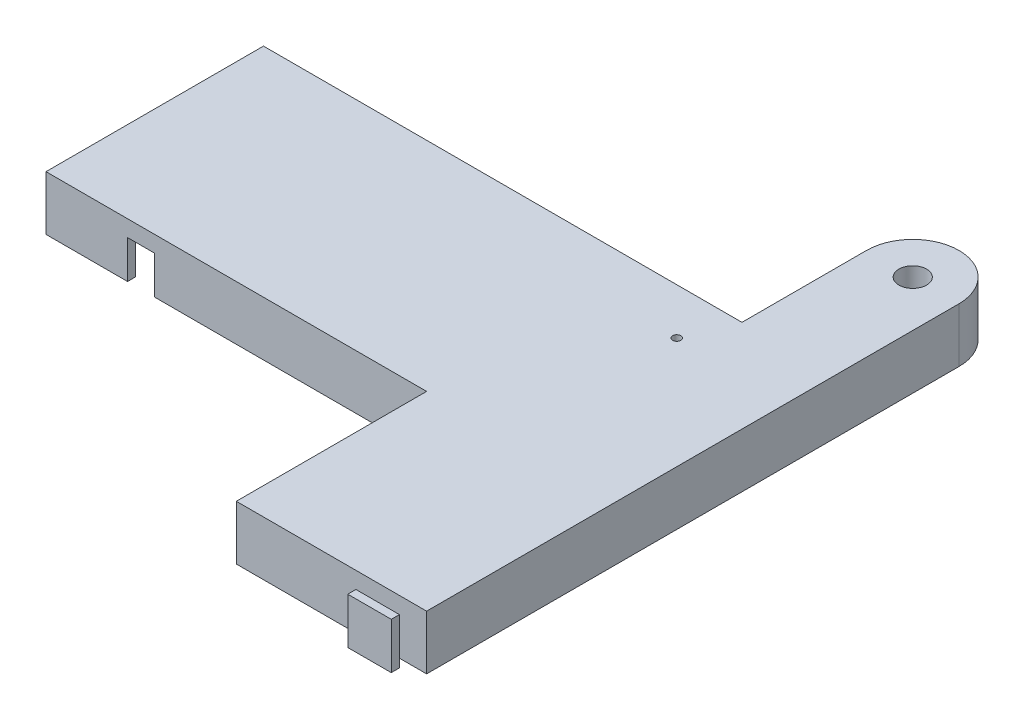
from build123d import *

# Parameters (mm, degrees)
CORNERBOSS_EXTRUDE1_DEPTH               = 20
SHELL1_T                                = -3
PADSKETCH2_R                            = 12
PADSKETCH2_R_2                          = 5
PADBOSS_EXTRUDE2_DEPTH                  = 10
STEPPERRODHOLESKETCH3_R                 = 5.1
STEPPERRODHOLESKETCH3_R_2               = 1.5
STEPPERRODHOLECUT_EXTRUDE1_DEPTH        = 255.298998474
THREADEDNUTMOUNTHOLESSKETCH4_R          = 1
THREADEDNUTMOUNTHOLESCUT_EXTRUDE2_DEPTH = 10
TLPEGHOLESKETCH1_W                      = 10
TLPEGHOLESKETCH1_H                      = 14
TLPEGHOLECUT_EXTRUDE1_DEPTH             = 3
BOTTOMPEGSKETCH2_W                      = 9.8
BOTTOMPEGSKETCH2_H                      = 13.9
BOTTOMPEGBOSS_EXTRUDE1_DEPTH            = 3.1
BOTTOMPEGCAPSKETCH3_W                   = 16
BOTTOMPEGCAPSKETCH3_H                   = 17
BOTTOMPEGCAPBOSS_EXTRUDE2_DEPTH         = 3
BEDCENTERHOLECUTSKETCH1_W               = 10
BEDCENTERHOLECUTSKETCH1_H               = 14
BEDCENTERHOLECUT_EXTRUDE1_DEPTH         = 3


with BuildPart() as part:
    # CornerSketch1 → CornerBoss-Extrude1 (new body)
    with BuildSketch(Plane(origin=(0, 0, 0), x_dir=(1, 0, 0), z_dir=(0, 1, 0))):
        with BuildLine():
            Line((210, -70), (140, -70))
            Line((140, -70), (140, 0))
            Line((140, 0), (0, 0))
            Line((0, 0), (0, 80))
            Line((0, 80), (176, 80))
            Line((176, 80), (176, 125.825))
            ThreePointArc((176, 125.825), (193, 142.825), (210, 125.825))
            Line((210, 125.825), (210, -70))
        make_face()
    extrude(amount=CORNERBOSS_EXTRUDE1_DEPTH)

    # Shell1
    shell1_openings = [part.faces().sort_by_distance(p)[0] for p in [
        (126.932214483, 0, -30.416556174),
    ]]
    offset(amount=SHELL1_T, openings=shell1_openings, kind=Kind.INTERSECTION)

    # PadSketch2 → PadBoss-Extrude2 (add)
    with BuildSketch(Plane.XZ.offset(-17)):
        with Locations((193, -125.825)):
            Circle(PADSKETCH2_R)
        with Locations((169, -63)):
            Circle(PADSKETCH2_R_2)
    extrude(amount=PADBOSS_EXTRUDE2_DEPTH)

    # StepperRodHoleSketch3 → StepperRodHoleCut-Extrude1 (cut, through all)
    with BuildSketch(Plane.XZ.offset(-7)):
        with Locations((193, -125.825)):
            Circle(STEPPERRODHOLESKETCH3_R)
        with Locations((169, -63)):
            Circle(STEPPERRODHOLESKETCH3_R_2)
    extrude(amount=-STEPPERRODHOLECUT_EXTRUDE1_DEPTH, mode=Mode.SUBTRACT)

    # ThreadedNutMountHolesSketch4 → ThreadedNutMountHolesCut-Extrude2 (cut)
    with BuildSketch(Plane(origin=(0, 7, 0), x_dir=(-1, 0, 0), z_dir=(0, -1, 0))):
        with Locations((-193, 133.825)):
            Circle(THREADEDNUTMOUNTHOLESSKETCH4_R)
        with Locations((-185, 125.825)):
            Circle(THREADEDNUTMOUNTHOLESSKETCH4_R)
        with Locations((-201, 125.825)):
            Circle(THREADEDNUTMOUNTHOLESSKETCH4_R)
        with Locations((-193, 117.825)):
            Circle(THREADEDNUTMOUNTHOLESSKETCH4_R)
    extrude(amount=-THREADEDNUTMOUNTHOLESCUT_EXTRUDE2_DEPTH, mode=Mode.SUBTRACT)

    # TLPegHoleSketch1 → TLPegHoleCut-Extrude1 (cut)
    with BuildSketch(Plane.ZY):
        with Locations((-65, 7)):
            Rectangle(TLPEGHOLESKETCH1_W, TLPEGHOLESKETCH1_H)
    extrude(amount=-TLPEGHOLECUT_EXTRUDE1_DEPTH, mode=Mode.SUBTRACT)

    # BottomPegSketch2 → BottomPegBoss-Extrude1 (add)
    with BuildSketch(Plane.XY.offset(70)):
        with Locations((195, 6.95)):
            Rectangle(BOTTOMPEGSKETCH2_W, BOTTOMPEGSKETCH2_H)
    extrude(amount=BOTTOMPEGBOSS_EXTRUDE1_DEPTH)

    # BottomPegCapSketch3 → BottomPegCapBoss-Extrude2 (add)
    with BuildSketch(Plane.XY.offset(73.1)):
        with Locations((195.1, 8.5)):
            Rectangle(BOTTOMPEGCAPSKETCH3_W, BOTTOMPEGCAPSKETCH3_H)
    extrude(amount=BOTTOMPEGCAPBOSS_EXTRUDE2_DEPTH)

    # BedCenterHoleCutSketch1 → BedCenterHoleCut-Extrude1 (cut)
    with BuildSketch(Plane.XY):
        with Locations((35, 7)):
            Rectangle(BEDCENTERHOLECUTSKETCH1_W, BEDCENTERHOLECUTSKETCH1_H)
    extrude(amount=-BEDCENTERHOLECUT_EXTRUDE1_DEPTH, mode=Mode.SUBTRACT)


solid = part.part
